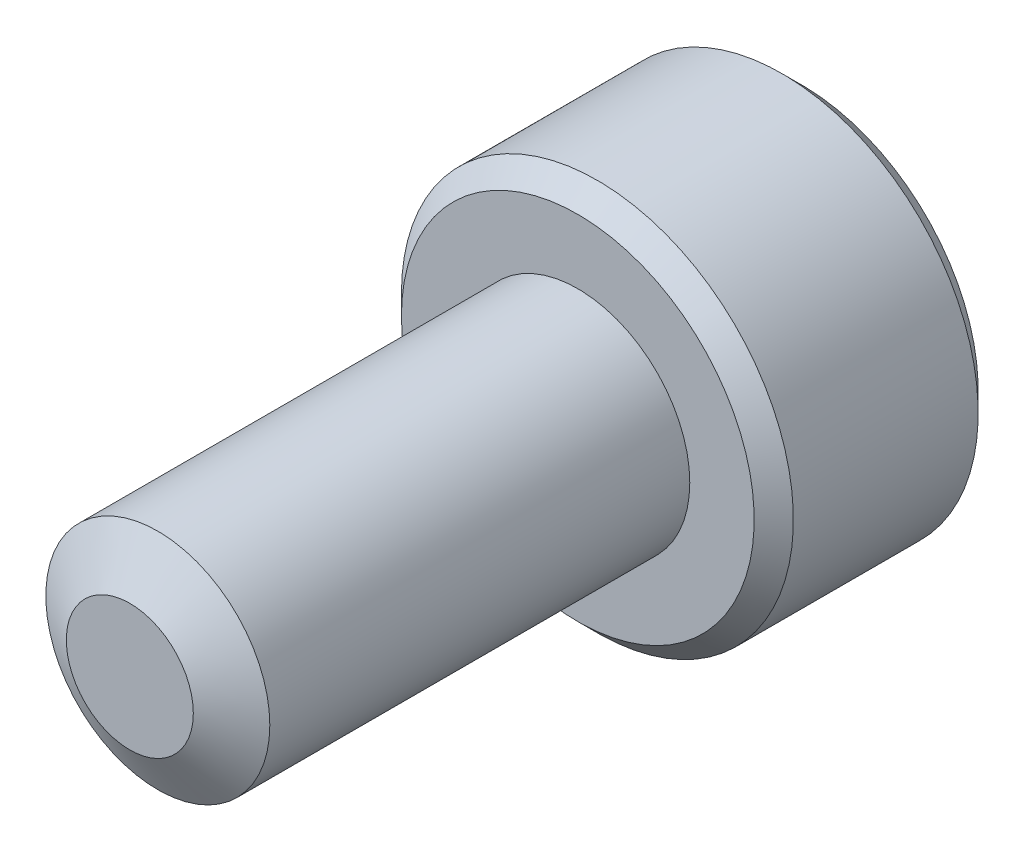
from build123d import *

# Parameters (mm, degrees)
SKETCH1_R           = 2
EXTRUDE1_DEPTH      = 8
CUT_SWEEP1_PITCH    = 0.7
SKETCH6_R           = 3.5
EXTRUDE2_DEPTH      = 4
CUT_EXTRUDE1_DEPTH  = 2.25
CHAMFER1_SIZE       = 0.35
SKETCH10_R          = 2
BOSS_EXTRUDE1_DEPTH = 8
CHAMFER2_SIZE       = 0.5
CHAMFER2_SIZE2      = 0.866025404


with BuildPart() as part:
    # Sketch1 → Extrude1 (new body)
    with BuildSketch(Plane.XY):
        Circle(SKETCH1_R)
    extrude(amount=-EXTRUDE1_DEPTH)

    # Cut-Sweep1: the profile of Sketch3 profile screwed along a right-hand helix of 12.428571 turns, 6 arcs to a turn; built about Z, then put on its axis
    cut_sweep1_z = Axis((0, 0, 0), (0, 0, 1))
    cut_sweep1_corners = [(2.0003, 0, -0.612673205), (1.545336663, 0, -0.35), (1.545336663, 0, -0.2625), (2.0003, 0, 0.000173205)]
    with BuildLine(mode=Mode.PRIVATE) as cut_sweep1_profile:
        Line(cut_sweep1_corners[0], cut_sweep1_corners[1])
        Line(cut_sweep1_corners[1], cut_sweep1_corners[2])
        Line(cut_sweep1_corners[2], cut_sweep1_corners[3])
        Line(cut_sweep1_corners[3], cut_sweep1_corners[0])
    cut_sweep1_cap = Face(cut_sweep1_profile.wire())
    cut_sweep1_turn_angles = [0, 30, 60, 90, 120, 150, 180, 210, 240, 270, 300, 330, 360]
    cut_sweep1_turn_weights = [1, 0.8660254037844387, 1, 0.8660254037844387, 1, 0.8660254037844387, 1, 0.8660254037844387, 1, 0.8660254037844387, 1, 0.8660254037844387, 1]
    cut_sweep1_turn_rails = [Edge.make_bspline([Vector(p[0], p[1], 0).rotate(cut_sweep1_z, cut_sweep1_turn_angles[k]) / cut_sweep1_turn_weights[k] + Vector(0, 0, p[2] + CUT_SWEEP1_PITCH * cut_sweep1_turn_angles[k] / 360) for k in range(13)], [0, 0, 0, 1, 1, 2, 2, 3, 3, 4, 4, 5, 5, 6, 6, 6], 2, cut_sweep1_turn_weights) for p in cut_sweep1_corners]
    cut_sweep1_turn_sides = [Face.make_surface_from_curves(cut_sweep1_turn_rails[p[0]], cut_sweep1_turn_rails[p[1]]) for p in [(0, 1), (1, 2), (2, 3), (3, 0)]]
    cut_sweep1_last_angles = [4320, 4350, 4380, 4410, 4440, 4457.142857143, 4474.285714286]
    cut_sweep1_last_weights = [1, 0.8660254037844387, 1, 0.8660254037844387, 1, 0.9555728057861561, 1]
    cut_sweep1_last_rails = [Edge.make_bspline([Vector(p[0], p[1], 0).rotate(cut_sweep1_z, cut_sweep1_last_angles[k]) / cut_sweep1_last_weights[k] + Vector(0, 0, p[2] + CUT_SWEEP1_PITCH * cut_sweep1_last_angles[k] / 360) for k in range(7)], [0, 0, 0, 1, 1, 2, 2, 3, 3, 3], 2, cut_sweep1_last_weights) for p in cut_sweep1_corners]
    cut_sweep1_last_sides = [Face.make_surface_from_curves(cut_sweep1_last_rails[p[0]], cut_sweep1_last_rails[p[1]]) for p in [(0, 1), (1, 2), (2, 3), (3, 0)]]
    cut_sweep1 = Plane(origin=(0, 0, 0), x_dir=(0, 1, 0), z_dir=(0, 0, -1)) * Solid(Shell([*[p.moved(Location((0, 0, CUT_SWEEP1_PITCH * i))) for i in range(12) for p in cut_sweep1_turn_sides], *cut_sweep1_last_sides, cut_sweep1_cap, cut_sweep1_cap.rotate(cut_sweep1_z, 4474.285714286).moved(Location((0, 0, CUT_SWEEP1_PITCH * 4474.285714286 / 360)))]))
    add(cut_sweep1, mode=Mode.SUBTRACT)

    # Sketch4 → Cut-Revolve1 (revolve, cut)
    with BuildSketch(Plane(origin=(0, 0, 0), x_dir=(0, 0, -1), z_dir=(1, 0, 0)), mode=Mode.PRIVATE) as cut_revolve1_sk:
        Polygon((0.496211411, 2), (0, 1.291336663), (0, 2), align=None)
    revolve(cut_revolve1_sk.sketch.rotate(Axis((0, 0, 0), (0, 0, -1)), 271.401126896), axis=Axis((0, 0, 0), (0, 0, -1)), mode=Mode.SUBTRACT)

    # Sketch6 → Extrude2 (add)
    with BuildSketch(Plane(origin=(0, 0, -8), x_dir=(-1, 0, 0), z_dir=(0, 0, -1))):
        Circle(SKETCH6_R)
    extrude(amount=EXTRUDE2_DEPTH)

    # Sketch7 → Cut-Extrude1 (cut)
    with BuildSketch(Plane(origin=(0, 0, -12), x_dir=(-1, 0, 0), z_dir=(0, 0, -1))):
        Polygon((0, 1.732050808), (-1.5, 0.866025404), (-1.5, -0.866025404), (0, -1.732050808), (1.5, -0.866025404), (1.5, 0.866025404), align=None)
    extrude(amount=-CUT_EXTRUDE1_DEPTH, mode=Mode.SUBTRACT)

    # Cut-Extrude2 cone 1 section (through the dimple's axis) → Cut-Extrude2 (revolve, cut)
    with BuildSketch(Plane(origin=(0, 0, -12), x_dir=(0, 1, 0), z_dir=(1, 0, 0))):
        Polygon((0, 0), (1.732050808, 0), (0, 1.732050808), align=None)
    revolve(axis=Axis((0, 0, -12), (0, 0, 1)), mode=Mode.SUBTRACT)

    # Chamfer1
    chamfer1_edges = [part.edges().sort_by_distance(p)[0] for p in [
        (3.5, 0, -8),
        (3.5, 0, -12),
    ]]
    chamfer(chamfer1_edges, length=CHAMFER1_SIZE)

    # Sketch10 → Boss-Extrude1 (add)
    with BuildSketch(Plane.XY):
        Circle(SKETCH10_R)
    extrude(amount=-BOSS_EXTRUDE1_DEPTH)

    # Chamfer2
    chamfer2_edges = [part.edges().sort_by_distance(p)[0] for p in [
        (-2, 0, 0),
    ]]
    chamfer2_side = [part.faces().sort_by_distance(p)[0] for p in [
        (-2, 0, -4),
    ]]
    chamfer(chamfer2_edges, length=CHAMFER2_SIZE, length2=CHAMFER2_SIZE2, reference=chamfer2_side[0])


solid = part.part
